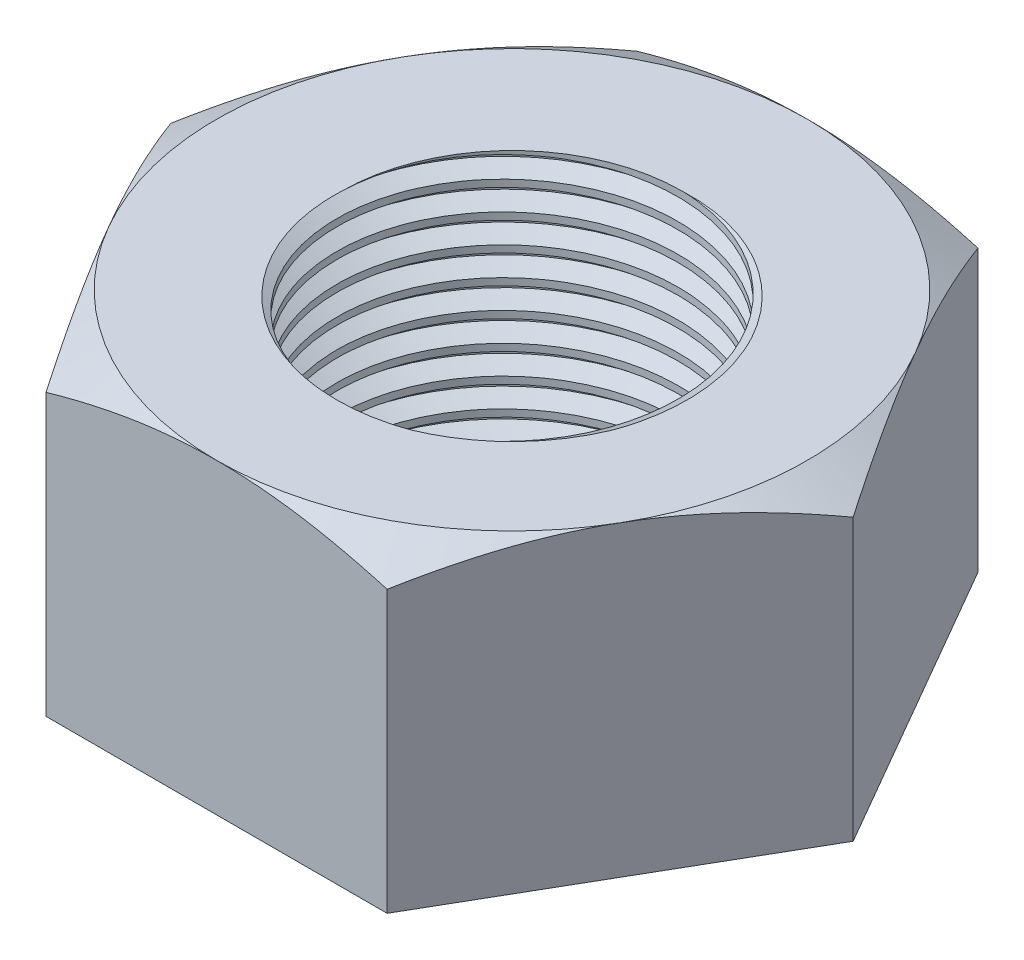
from build123d import *

# Parameters (mm, degrees)
BOSS_EXTRUDE1_DEPTH     = 21.6
CUT_EXTRUDE1_DEPTH      = 39.4
CUT_EXTRUDE1_DEPTH_BACK = 39.4
SKETCH5_R               = 12
THREAD1_PITCH           = 2


with BuildPart() as part:
    # Sketch1 → Boss-Extrude1 (new body)
    with BuildSketch(Plane(origin=(0, 0, 0), x_dir=(1, 0, 0), z_dir=(0, 1, 0))):
        Polygon((12, -20.784609691), (24, 0), (12, 20.784609691), (-12, 20.784609691), (-24, 0), (-12, -20.784609691), align=None)
    extrude(amount=BOSS_EXTRUDE1_DEPTH)

    # Sketch2 → Cut-Revolve1 (revolve, cut)
    with BuildSketch(Plane(origin=(0, 0, 0), x_dir=(0, 0, -1), z_dir=(1, 0, 0))):
        Polygon((20.784609691, 21.6), (24.248711306, 21.6), (24.248711306, 19.6), align=None)
    revolve(axis=Axis((0, 0, 0), (0, -1, 0)), mode=Mode.SUBTRACT)

    # Sketch5 → Cut-Extrude1 (cut, two sides: drawn at the far end of the back side and taken through both)
    with BuildSketch(Plane(origin=(0, 21.6, 0), x_dir=(1, 0, 0), z_dir=(0, 1, 0)).offset(-CUT_EXTRUDE1_DEPTH_BACK)):
        with Locations(Location((0, 0, 0), (0, 0, 270))):
            Circle(SKETCH5_R)
    extrude(amount=CUT_EXTRUDE1_DEPTH + CUT_EXTRUDE1_DEPTH_BACK, mode=Mode.SUBTRACT)

    # Thread1: the profile of Thread Profile1 profile screwed along a right-hand helix of 12.8 turns, 10 arcs to a turn; built about Z, then put on its axis
    thread1_z = Axis((0, 0, 0), (0, 0, 1))
    thread1_corners = [(11.9997, 0, -0.000173205), (13.08253175, 0, 0.624999997), (13.08253175, 0, 0.874999997), (11.9997, 0, 1.5001732)]
    with BuildLine(mode=Mode.PRIVATE) as thread1_profile:
        Line(thread1_corners[0], thread1_corners[1])
        Line(thread1_corners[1], thread1_corners[2])
        Line(thread1_corners[2], thread1_corners[3])
        Line(thread1_corners[3], thread1_corners[0])
    thread1_cap = Face(thread1_profile.wire())
    thread1_turn_angles = [0, 18, 36, 54, 72, 90, 108, 126, 144, 162, 180, 198, 216, 234, 252, 270, 288, 306, 324, 342, 360]
    thread1_turn_weights = [1, 0.9510565162951535, 1, 0.9510565162951535, 1, 0.9510565162951535, 1, 0.9510565162951535, 1, 0.9510565162951535, 1, 0.9510565162951535, 1, 0.9510565162951535, 1, 0.9510565162951535, 1, 0.9510565162951535, 1, 0.9510565162951535, 1]
    thread1_turn_rails = [Edge.make_bspline([Vector(p[0], p[1], 0).rotate(thread1_z, thread1_turn_angles[k]) / thread1_turn_weights[k] + Vector(0, 0, p[2] + THREAD1_PITCH * thread1_turn_angles[k] / 360) for k in range(21)], [0, 0, 0, 1, 1, 2, 2, 3, 3, 4, 4, 5, 5, 6, 6, 7, 7, 8, 8, 9, 9, 10, 10, 10], 2, thread1_turn_weights) for p in thread1_corners]
    thread1_turn_sides = [Face.make_surface_from_curves(thread1_turn_rails[p[0]], thread1_turn_rails[p[1]]) for p in [(0, 1), (1, 2), (2, 3), (3, 0)]]
    thread1_last_angles = [4320, 4338, 4356, 4374, 4392, 4410, 4428, 4446, 4464, 4482, 4500, 4518, 4536, 4554, 4572, 4590, 4608]
    thread1_last_weights = [1, 0.9510565162951535, 1, 0.9510565162951535, 1, 0.9510565162951535, 1, 0.9510565162951535, 1, 0.9510565162951535, 1, 0.9510565162951535, 1, 0.9510565162951535, 1, 0.9510565162951535, 1]
    thread1_last_rails = [Edge.make_bspline([Vector(p[0], p[1], 0).rotate(thread1_z, thread1_last_angles[k]) / thread1_last_weights[k] + Vector(0, 0, p[2] + THREAD1_PITCH * thread1_last_angles[k] / 360) for k in range(17)], [0, 0, 0, 1, 1, 2, 2, 3, 3, 4, 4, 5, 5, 6, 6, 7, 7, 8, 8, 8], 2, thread1_last_weights) for p in thread1_corners]
    thread1_last_sides = [Face.make_surface_from_curves(thread1_last_rails[p[0]], thread1_last_rails[p[1]]) for p in [(0, 1), (1, 2), (2, 3), (3, 0)]]
    thread1 = Plane(origin=(0, 25.6, 0), x_dir=(-1, 0, 0), z_dir=(0, -1, 0)) * Solid(Shell([*[p.moved(Location((0, 0, THREAD1_PITCH * i))) for i in range(12) for p in thread1_turn_sides], *thread1_last_sides, thread1_cap, thread1_cap.rotate(thread1_z, 4608).moved(Location((0, 0, THREAD1_PITCH * 4608 / 360)))]))
    add(thread1, mode=Mode.SUBTRACT)


solid = part.part
